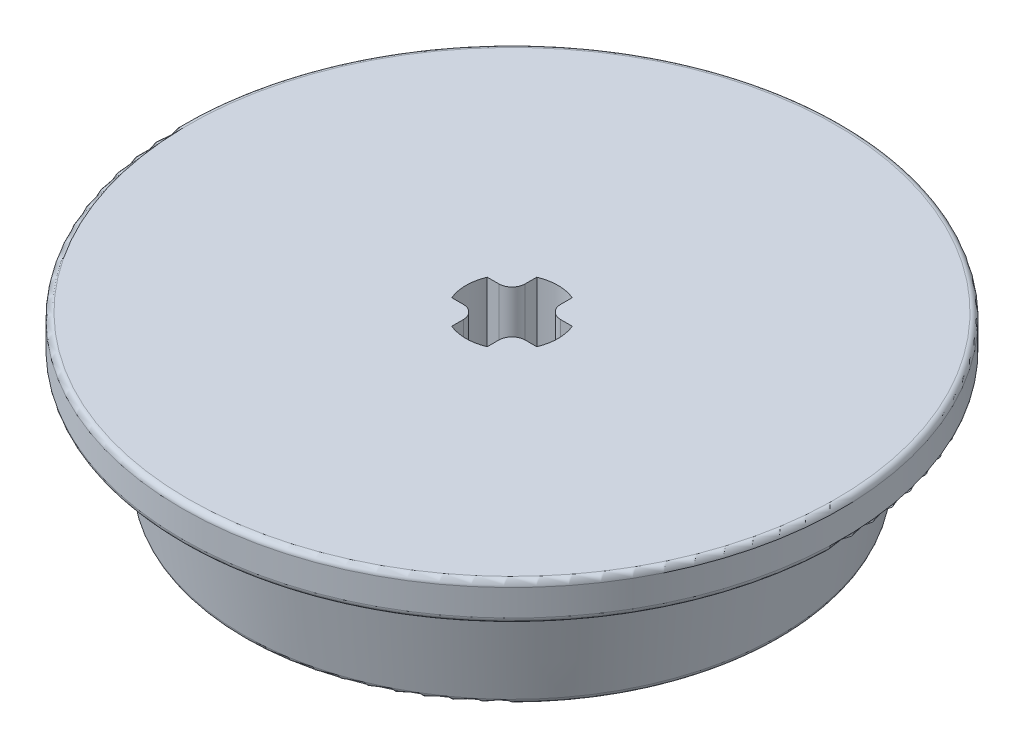
from build123d import *

# Parameters (mm, degrees)
CUT_EXTRUDE1_DEPTH = 26.956426849
FILLET1_R          = 0.7
FILLET2_R          = 0.3


with BuildPart() as part:
    # Sketch2 → Revolve1 (revolve)
    with BuildSketch(Plane.XY):
        Polygon((0, 0), (17.460470996, 0), (17.460470996, -2), (15, -2), (14.156754992, -8), (0, -8), align=None)
    revolve(axis=Axis((0, 0, 0), (0, 1, 0)))

    # Sketch1 → Cut-Extrude1 (cut, through all)
    with BuildSketch(Plane(origin=(0, 0, 0), x_dir=(1, 0, 0), z_dir=(0, 1, 0))):
        with BuildLine():
            Line((-0.94, 0.94), (-2.25166605, 0.94))
            ThreePointArc((-2.25166605, 0.94), (-2.44, 0), (-2.25166605, -0.94))
            Line((-2.25166605, -0.94), (-0.94, -0.94))
            Line((-0.94, -0.94), (-0.94, -2.25166605))
            ThreePointArc((-0.94, -2.25166605), (0, -2.44), (0.94, -2.25166605))
            Line((0.94, -2.25166605), (0.94, -0.94))
            Line((0.94, -0.94), (2.25166605, -0.94))
            ThreePointArc((2.25166605, -0.94), (2.44, 0), (2.25166605, 0.94))
            Line((2.25166605, 0.94), (0.94, 0.94))
            Line((0.94, 0.94), (0.94, 2.25166605))
            ThreePointArc((0.94, 2.25166605), (0, 2.44), (-0.94, 2.25166605))
            Line((-0.94, 2.25166605), (-0.94, 0.94))
        make_face()
    extrude(amount=-CUT_EXTRUDE1_DEPTH, mode=Mode.SUBTRACT)

    # Fillet1
    fillet1_edges = [part.edges().sort_by_distance(p)[0] for p in [
        (-0.94, -4, 0.94),
        (0.94, -4, 0.94),
        (0.94, -4, -0.94),
        (-0.94, -4, -0.94),
    ]]
    fillet(fillet1_edges, radius=FILLET1_R)

    # Fillet2
    fillet2_edges = [part.edges().sort_by_distance(p)[0] for p in [
        (-14.156754992, -8, 0),
        (-17.460470996, 0, 0),
        (-15, -2, 0),
        (-17.460470996, -2, 0),
    ]]
    fillet(fillet2_edges, radius=FILLET2_R)


solid = part.part
